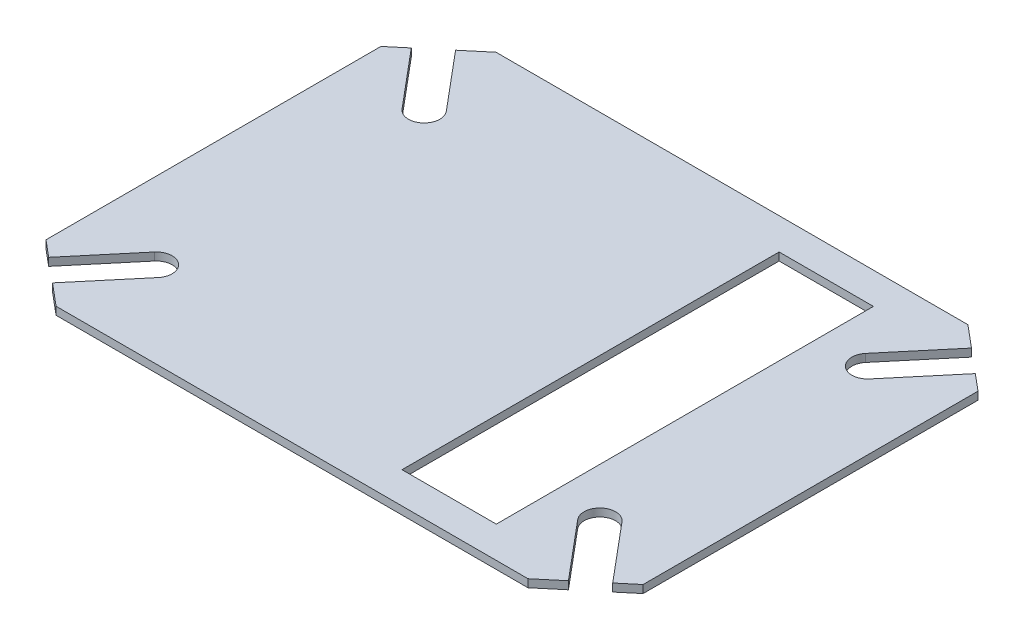
from build123d import *

# Parameters (mm, degrees)
BOSS_EXTRUDE1_DEPTH = 3.175
SKETCH2_W           = 38.1
SKETCH2_H           = 152.4
CUT_EXTRUDE1_DEPTH  = 150.899009753


with BuildPart() as part:
    # Sketch1 → Boss-Extrude1 (new body)
    with BuildSketch(Plane(origin=(0, 0, 0), x_dir=(1, 0, 0), z_dir=(0, 1, 0))):
        with BuildLine():
            Line((-113.972215143, 73.276131608), (-120.65, 67.672804797))
            Line((-120.65, 67.672804797), (-120.65, -67.672804797))
            Line((-120.65, -67.672804797), (-113.972215143, -73.276131608))
            Line((-113.972215143, -73.276131608), (-94.467319108, -50.031101684))
            ThreePointArc((-94.467319108, -50.031101684), (-85.521235572, -49.248420792), (-84.73855468, -58.194504327))
            Line((-84.73855468, -58.194504327), (-104.243450716, -81.439534251))
            Line((-104.243450716, -81.439534251), (-95.352413857, -88.9))
            Line((-95.352413857, -88.9), (95.352413857, -88.9))
            Line((95.352413857, -88.9), (104.243450716, -81.439534251))
            Line((104.243450716, -81.439534251), (84.73855468, -58.194504327))
            ThreePointArc((84.73855468, -58.194504327), (85.521235572, -49.248420792), (94.467319108, -50.031101684))
            Line((94.467319108, -50.031101684), (113.972215143, -73.276131608))
            Line((113.972215143, -73.276131608), (120.65, -67.672804797))
            Line((120.65, -67.672804797), (120.65, 67.672804797))
            Line((120.65, 67.672804797), (113.972215143, 73.276131608))
            Line((113.972215143, 73.276131608), (94.467319108, 50.031101684))
            ThreePointArc((94.467319108, 50.031101684), (85.521235572, 49.248420792), (84.73855468, 58.194504327))
            Line((84.73855468, 58.194504327), (104.243450716, 81.439534251))
            Line((104.243450716, 81.439534251), (95.352413857, 88.9))
            Line((95.352413857, 88.9), (-95.352413857, 88.9))
            Line((-95.352413857, 88.9), (-104.243450716, 81.439534251))
            Line((-104.243450716, 81.439534251), (-84.73855468, 58.194504327))
            ThreePointArc((-84.73855468, 58.194504327), (-85.521235572, 49.248420792), (-94.467319108, 50.031101684))
            Line((-94.467319108, 50.031101684), (-113.972215143, 73.276131608))
        make_face()
    extrude(amount=BOSS_EXTRUDE1_DEPTH)

    # Sketch2 → Cut-Extrude1 (cut, through all)
    with BuildSketch(Plane(origin=(0, 3.175, 0), x_dir=(1, 0, 0), z_dir=(0, 1, 0))):
        with Locations((50.8, 0)):
            Rectangle(SKETCH2_W, SKETCH2_H)
    extrude(amount=-CUT_EXTRUDE1_DEPTH, mode=Mode.SUBTRACT)


solid = part.part
